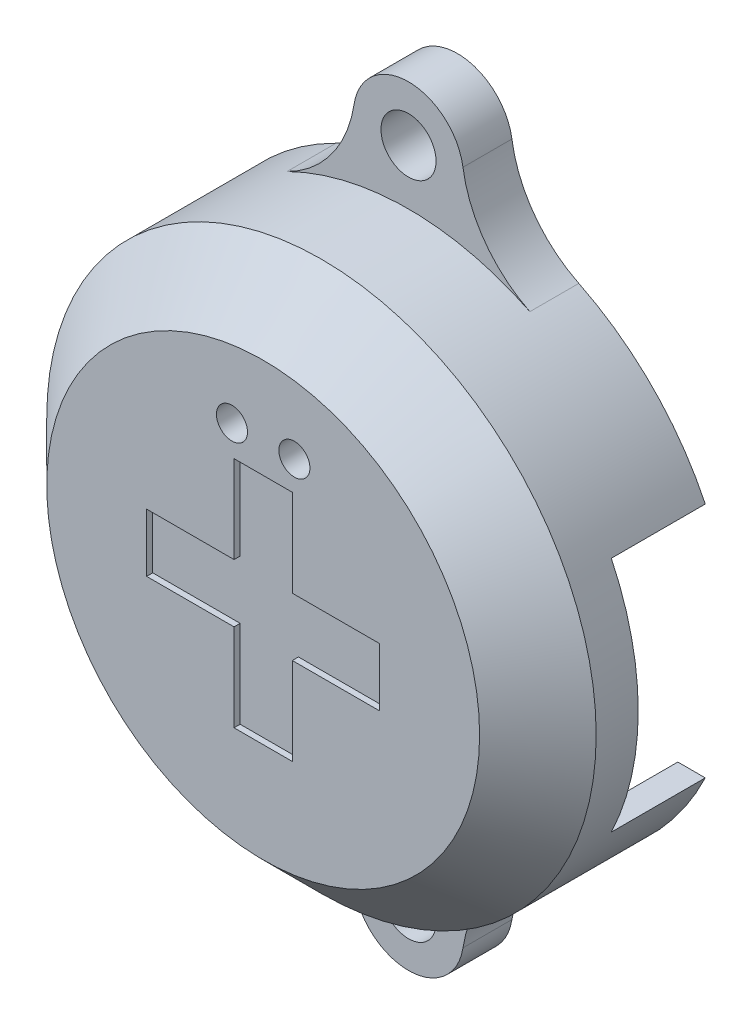
from build123d import *
from build123d.topology import SkipClean

# Parameters (mm, degrees)
BOSS_EXTRUDE1_DEPTH     = 15.875
CUT_EXTRUDE2_START      = -11.875
CUT_EXTRUDE2_DEPTH      = 11.875
M4_CLEARANCE_HOLE1_D    = 4.5
CHAMFER1_SIZE           = 4.7625
SHELL1_OUTLINE_R        = 20.45
SHELL1_DEPTH            = 10.284072775
SHELL1_2_DEPTH          = 2
BOSS_EXTRUDE2_START     = 2
BOSS_EXTRUDE2_DEPTH     = 2
SKETCH7_W               = 7.14375
SKETCH7_H               = 4.7625
SKETCH7_W_2             = 4.7625
SKETCH7_H_2             = 7.14375
CUT_EXTRUDE5_DEPTH      = 0.5
CUT_EXTRUDE7_DEPTH      = 42.774640932
CUT_EXTRUDE7_DEPTH_BACK = 42.774640932
SKETCH9_W               = 6.175
SKETCH9_H               = 19.378
SKETCH9_W_2             = 3.175
SKETCH9_H_2             = 16.378
SKETCH9_W_3             = 1.5018
SKETCH12_R              = 1.27
CUT_EXTRUDE10_DEPTH     = 42.774640932


with BuildPart() as part:
    # Sketch1 → Boss-Extrude1 (new body)
    with BuildSketch(Plane.XY):
        with BuildLine():
            ThreePointArc((-9.919608253, 20.139609532), (-22.45, 0), (-9.919608253, -20.139609532))
            ThreePointArc((-9.919608253, -20.139609532), (-6.265793461, -23.208178662), (-4.449768206, -27.62049453))
            ThreePointArc((-4.449768206, -27.62049453), (0, -31.45), (4.449768206, -27.62049453))
            ThreePointArc((4.449768206, -27.62049453), (6.265793461, -23.208178662), (9.919608253, -20.139609532))
            ThreePointArc((9.919608253, -20.139609532), (22.45, 0), (9.919608253, 20.139609532))
            ThreePointArc((9.919608253, 20.139609532), (6.265793461, 23.208178662), (4.449768206, 27.62049453))
            ThreePointArc((4.449768206, 27.62049453), (0, 31.45), (-4.449768206, 27.62049453))
            ThreePointArc((-4.449768206, 27.62049453), (-6.265793461, 23.208178662), (-9.919608253, 20.139609532))
        make_face()
    extrude(amount=BOSS_EXTRUDE1_DEPTH)

    # Sketch3 → Cut-Extrude2 (cut)
    with SkipClean():  # the faces are left unmerged after this step: merging them gives an invalid solid
        with BuildSketch(Plane.XY.offset(15.875).offset(CUT_EXTRUDE2_START)):
            with BuildLine():
                ThreePointArc((-4.449768206, 27.62049453), (-6.265793461, 23.208178662), (-9.919608253, 20.139609532))
                ThreePointArc((-9.919608253, 20.139609532), (0, 22.45), (9.919608253, 20.139609532))
                ThreePointArc((9.919608253, 20.139609532), (6.265793461, 23.208178662), (4.449768206, 27.62049453))
                ThreePointArc((4.449768206, 27.62049453), (0, 31.45), (-4.449768206, 27.62049453))
            make_face()
            with BuildLine():
                ThreePointArc((9.919608253, -20.139609532), (0, -22.45), (-9.919608253, -20.139609532))
                ThreePointArc((-9.919608253, -20.139609532), (-6.265793461, -23.208178662), (-4.449768206, -27.62049453))
                ThreePointArc((-4.449768206, -27.62049453), (0, -31.45), (4.449768206, -27.62049453))
                ThreePointArc((4.449768206, -27.62049453), (6.265793461, -23.208178662), (9.919608253, -20.139609532))
            make_face()
        extrude(amount=CUT_EXTRUDE2_DEPTH, mode=Mode.SUBTRACT)

    # M4 Clearance Hole1 (through all)
    with Locations(Plane.XY.offset(4)):
        with Locations((0, -26.95), (0, 26.95)):
            Hole(M4_CLEARANCE_HOLE1_D / 2)

    # Chamfer1
    chamfer1_edges = [part.edges().sort_by_distance(p)[0] for p in [
        (22.45, 0, 15.875),
    ]]
    chamfer(chamfer1_edges, length=CHAMFER1_SIZE)

    # Shell1: read off the stored shape, not the designer's step
    # Shell1 outline → Shell1 (cut)
    with SkipClean():  # the faces are left unmerged after this step: merging them gives an invalid solid
        with BuildSketch(Plane.XY):
            Circle(SHELL1_OUTLINE_R)
        extrude(amount=SHELL1_DEPTH, mode=Mode.SUBTRACT)

    # Shell1 2 outline → Shell1 2 (cut)
    with SkipClean():  # the faces are left unmerged after this step: merging them gives an invalid solid
        with BuildSketch(Plane.XY):
            with BuildLine():
                ThreePointArc((-3.336769132, -24.317800965), (0, -22.7), (3.336769132, -24.317800965))
                ThreePointArc((3.336769132, -24.317800965), (5.656595992, -20.826114024), (9.035901505, -18.345434963))
                ThreePointArc((9.035901505, -18.345434963), (0, -20.45), (-9.035901505, -18.345434963))
                ThreePointArc((-9.035901505, -18.345434963), (-5.656595992, -20.826114024), (-3.336769132, -24.317800965))
            make_face()
            with BuildLine():
                ThreePointArc((-3.336769132, 24.317800965), (-5.656595992, 20.826114024), (-9.035901505, 18.345434963))
                ThreePointArc((-9.035901505, 18.345434963), (0, 20.45), (9.035901505, 18.345434963))
                ThreePointArc((9.035901505, 18.345434963), (5.656595992, 20.826114024), (3.336769132, 24.317800965))
                ThreePointArc((3.336769132, 24.317800965), (0, 22.7), (-3.336769132, 24.317800965))
            make_face()
        extrude(amount=SHELL1_2_DEPTH, mode=Mode.SUBTRACT)

    # Shell1 3 outline → Shell1 3 (revolve, cut)
    with SkipClean():  # the faces are left unmerged after this step: merging them gives an invalid solid
        with BuildSketch(Plane.XZ):
            Polygon((16.859072875, 13.875), (0, 13.875), (0, 10.284072775), (20.45, 10.284072775), align=None)
        revolve(axis=Axis((0, 0, 0), (0, 0, 1)), mode=Mode.SUBTRACT)

    # Sketch6 → Boss-Extrude2 (add)
    with SkipClean():  # the faces are left unmerged after this step: merging them gives an invalid solid
        with BuildSketch(Plane(origin=(0, 0, 2), x_dir=(-1, 0, 0), z_dir=(0, 0, -1)).offset(BOSS_EXTRUDE2_START)):
            with BuildLine():
                ThreePointArc((3.336769132, -24.317800965), (0, -22.7), (-3.336769132, -24.317800965))
                ThreePointArc((-3.336769132, -24.317800965), (-5.656595992, -20.826114024), (-9.035901505, -18.345434963))
                ThreePointArc((-9.035901505, -18.345434963), (0, -20.45), (9.035901505, -18.345434963))
                ThreePointArc((9.035901505, -18.345434963), (5.656595992, -20.826114024), (3.336769132, -24.317800965))
            make_face()
            with BuildLine():
                ThreePointArc((-9.035901505, 18.345434963), (-5.656595992, 20.826114024), (-3.336769132, 24.317800965))
                ThreePointArc((-3.336769132, 24.317800965), (0, 22.7), (3.336769132, 24.317800965))
                ThreePointArc((3.336769132, 24.317800965), (5.656595992, 20.826114024), (9.035901505, 18.345434963))
                ThreePointArc((9.035901505, 18.345434963), (0, 20.45), (-9.035901505, 18.345434963))
            make_face()
        extrude(amount=-BOSS_EXTRUDE2_DEPTH)

    # Sketch7 → Cut-Extrude5 (cut)
    with SkipClean():  # the faces are left unmerged after this step: merging them gives an invalid solid
        with BuildSketch(Plane.XY.offset(15.875)):
            with Locations((-5.953125, 0)):
                Rectangle(SKETCH7_W, SKETCH7_H)
            Rectangle(SKETCH7_W_2, SKETCH7_H)
            with Locations((5.953125, 0)):
                Rectangle(SKETCH7_W, SKETCH7_H)
            with Locations((0, -5.953125)):
                Rectangle(SKETCH7_W_2, SKETCH7_H_2)
            with Locations((0, 5.953125)):
                Rectangle(SKETCH7_W_2, SKETCH7_H_2)
        extrude(amount=-CUT_EXTRUDE5_DEPTH, mode=Mode.SUBTRACT)

    # Sketch9 → Cut-Extrude7 (cut, two sides: drawn at the far end of the back side and taken through both)
    # profile 1 of 3: a face of its own
    with SkipClean():  # the faces are left unmerged after this step: merging them gives an invalid solid
        with BuildSketch(Plane(origin=(0, 0, 0), x_dir=(0, 0, -1), z_dir=(1, 0, 0)).offset(-CUT_EXTRUDE7_DEPTH_BACK)):
            with Locations((-4.5893, 0)):
                Rectangle(SKETCH9_W, SKETCH9_H)
            with Locations((-4.5893, 0)):
                Rectangle(SKETCH9_W_2, SKETCH9_H_2, mode=Mode.SUBTRACT)
        # profile 2 of 3: a face of its own
        with BuildSketch(Plane(origin=(0, 0, 0), x_dir=(0, 0, -1), z_dir=(1, 0, 0)).offset(-CUT_EXTRUDE7_DEPTH_BACK)):
            with Locations((-0.7509, 0)):
                Rectangle(SKETCH9_W_3, SKETCH9_H)
        # profile 3 of 3: a face of its own
        with BuildSketch(Plane(origin=(0, 0, 0), x_dir=(0, 0, -1), z_dir=(1, 0, 0)).offset(-CUT_EXTRUDE7_DEPTH_BACK)):
            with Locations((-4.5893, 0)):
                Rectangle(SKETCH9_W_2, SKETCH9_H_2)
        extrude(amount=CUT_EXTRUDE7_DEPTH + CUT_EXTRUDE7_DEPTH_BACK, mode=Mode.SUBTRACT)

    # Sketch12 → Cut-Extrude10 (cut, through all)
    with SkipClean():  # the faces are left unmerged after this step: merging them gives an invalid solid
        with BuildSketch(Plane.XY.offset(15.875)):
            with Locations((-2.55, 11.95)):
                Circle(SKETCH12_R)
            with Locations((2.55, 11.95)):
                Circle(SKETCH12_R)
        extrude(amount=-CUT_EXTRUDE10_DEPTH, mode=Mode.SUBTRACT)


solid = part.part
